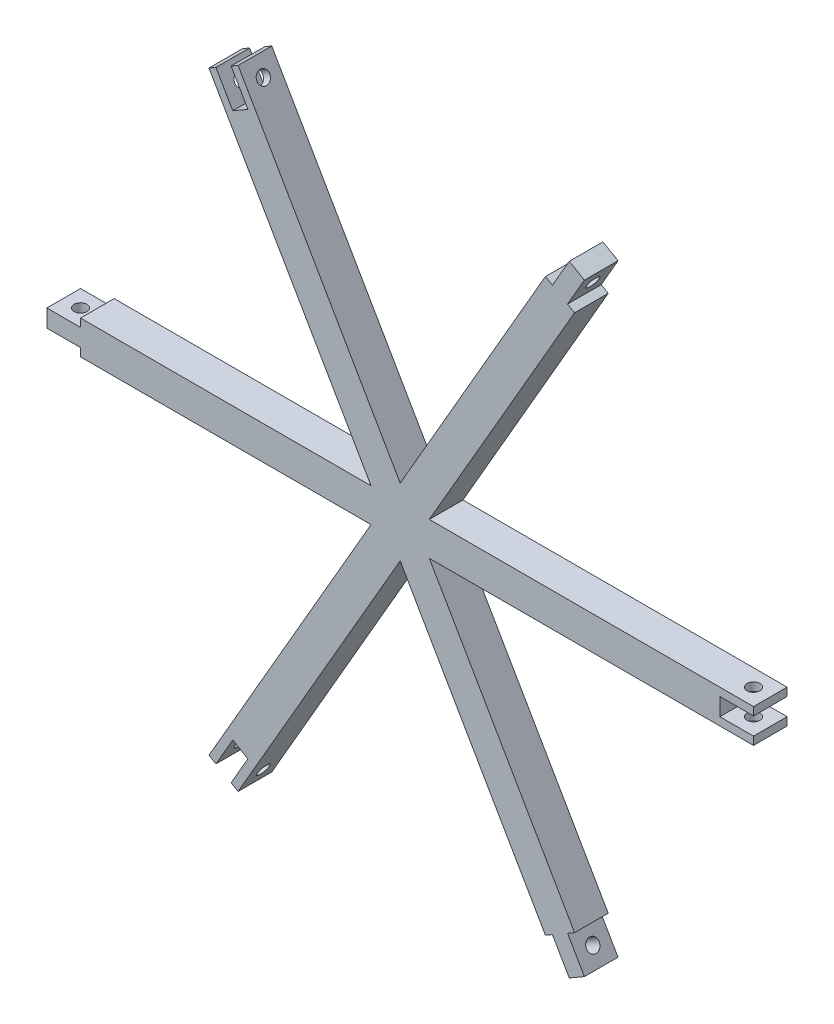
from build123d import *

# Parameters (mm, degrees)
SKETCH1_W               = 5
SKETCH1_H               = 5
SKETCH1_R               = 0.95
CENTER_DEPTH            = 1.3
RIGHTSIDE_START         = 1.3
SKETCH1_2_W             = 5
SKETCH1_2_H             = 5
SKETCH1_2_R             = 0.95
RIGHTSIDE_DEPTH         = 1.2
LEFTSIDE_START          = -1.3
SKETCH1_3_W             = 5
SKETCH1_3_H             = 5
SKETCH1_3_R             = 0.95
LEFTSIDE_DEPTH          = 1.2
SKETCH3_W               = 5
SKETCH3_H               = 5
BOSS_EXTRUDE4_DEPTH     = 47.5
CUT_EXTRUDE1_DEPTH      = 5
CIRPATTERN2_COUNT       = 6
CIRPATTERN3_COUNT       = 3
CIRPATTERN4_START       = -44.601270189
CIRPATTERN4_OUTLINE_W   = 5
CIRPATTERN4_OUTLINE_H   = 5
CIRPATTERN4_OUTLINE_R   = 0.95
CIRPATTERN4_DEPTH       = 2.6
CIRPATTERN4_2_OUTLINE_W = 5
CIRPATTERN4_2_OUTLINE_H = 5
CIRPATTERN4_2_OUTLINE_R = 0.95
CIRPATTERN4_2_DEPTH     = 2.6
CIRPATTERN4_START_2     = -1.3
CIRPATTERN4_3_OUTLINE_W = 5
CIRPATTERN4_3_OUTLINE_H = 5
CIRPATTERN4_3_OUTLINE_R = 0.95
CIRPATTERN4_3_DEPTH     = 2.6
SKETCH5_W               = 5
SKETCH5_H               = 2.6
CUT_EXTRUDE2_DEPTH      = 5


# Read off the part's stored shape, not the designer's step: CirPattern4
with BuildPart() as part:
    # Sketch1 → Center (new, symmetric)
    with BuildSketch(Plane(origin=(0, 0, 0), x_dir=(1, 0, 0), z_dir=(0, 1, 0))):
        Rectangle(SKETCH1_W, SKETCH1_H)
        with Locations(Location((0, 0, 0), (0, 0, 270))):
            Circle(SKETCH1_R, mode=Mode.SUBTRACT)
    extrude(amount=CENTER_DEPTH, both=True)

    # Sketch5 → Cut-Extrude2 (cut)
    with BuildSketch(Plane(origin=(2.5, 0, 0), x_dir=(0, 0, -1), z_dir=(1, 0, 0))):
        Rectangle(SKETCH5_W, SKETCH5_H)
    extrude(amount=-CUT_EXTRUDE2_DEPTH, mode=Mode.SUBTRACT)


with BuildPart() as body_2:
    # Sketch1<2> → RightSide (new body)
    with BuildSketch(Plane(origin=(0, 0, 0), x_dir=(1, 0, 0), z_dir=(0, 1, 0)).offset(RIGHTSIDE_START)):
        Rectangle(SKETCH1_2_W, SKETCH1_2_H)
        with Locations(Location((0, 0, 0), (0, 0, 270))):
            Circle(SKETCH1_2_R, mode=Mode.SUBTRACT)
    extrude(amount=RIGHTSIDE_DEPTH)


with BuildPart() as body_3:
    # Sketch1<3> → LeftSide (new body)
    with BuildSketch(Plane(origin=(0, 0, 0), x_dir=(1, 0, 0), z_dir=(0, 1, 0)).offset(LEFTSIDE_START)):
        Rectangle(SKETCH1_3_W, SKETCH1_3_H)
        with Locations(Location((0, 0, 0), (0, 0, 270))):
            Circle(SKETCH1_3_R, mode=Mode.SUBTRACT)
    extrude(amount=-LEFTSIDE_DEPTH)


with BuildPart() as body_4:
    # Sketch3 → Boss-Extrude4 (new body)
    with BuildSketch(Plane.ZY.offset(2.5)):
        Rectangle(SKETCH3_W, SKETCH3_H)
    extrude(amount=BOSS_EXTRUDE4_DEPTH)

    # Sketch4 → Cut-Extrude1 (cut)
    with BuildSketch(Plane.XY.offset(-2.5)):
        Polygon((-50, 0), (-50, -2.5), (-45.669872981, -2.5), align=None)
        Polygon((-50, 2.5), (-50, 0), (-45.669872981, 2.5), align=None)
    extrude(amount=CUT_EXTRUDE1_DEPTH, mode=Mode.SUBTRACT)


with BuildPart() as cirpattern2_1:
    # CirPattern2: pattern copy
    add(body_4.part.rotate(Axis((-50, 0, 0), (0, 0, 1)), 1 * 360 / CIRPATTERN2_COUNT))


with BuildPart() as cirpattern2_2:
    # CirPattern2: pattern copy
    add(body_4.part.rotate(Axis((-50, 0, 0), (0, 0, 1)), 2 * 360 / CIRPATTERN2_COUNT))


with BuildPart() as cirpattern2_3:
    # CirPattern2: pattern copy
    add(body_4.part.rotate(Axis((-50, 0, 0), (0, 0, 1)), 3 * 360 / CIRPATTERN2_COUNT))


with BuildPart() as cirpattern2_4:
    # CirPattern2: pattern copy
    add(body_4.part.rotate(Axis((-50, 0, 0), (0, 0, 1)), 4 * 360 / CIRPATTERN2_COUNT))


with BuildPart() as cirpattern2_5:
    # CirPattern2: pattern copy
    add(body_4.part.rotate(Axis((-50, 0, 0), (0, 0, 1)), 5 * 360 / CIRPATTERN2_COUNT))


with BuildPart() as cirpattern3_1:
    # CirPattern3: pattern copy
    add(body_3.part.rotate(Axis((-50, 0, 0), (0, 0, 1)), 1 * 360 / CIRPATTERN3_COUNT))


with BuildPart() as cirpattern3_2:
    # CirPattern3: pattern copy
    add(body_3.part.rotate(Axis((-50, 0, 0), (0, 0, 1)), 2 * 360 / CIRPATTERN3_COUNT))


with BuildPart() as cirpattern3_3:
    # CirPattern3: pattern copy
    add(body_2.part.rotate(Axis((-50, 0, 0), (0, 0, 1)), 1 * 360 / CIRPATTERN3_COUNT))


with BuildPart() as cirpattern3_4:
    # CirPattern3: pattern copy
    add(body_2.part.rotate(Axis((-50, 0, 0), (0, 0, 1)), 2 * 360 / CIRPATTERN3_COUNT))


with BuildPart() as body_14:
    # CirPattern4 outline → CirPattern4 (new body)
    with BuildSketch(Plane(origin=(0, 0, 0), x_dir=(0.49999999999999767, 0.86602540378444, 0), z_dir=(0.8660254037844399, -0.49999999999999795, 0)).offset(CIRPATTERN4_START)):
        with Locations((25, 0)):
            Rectangle(CIRPATTERN4_OUTLINE_W, CIRPATTERN4_OUTLINE_H)
        with Locations((25, 0)):
            Circle(CIRPATTERN4_OUTLINE_R, mode=Mode.SUBTRACT)
    extrude(amount=CIRPATTERN4_DEPTH)


with BuildPart() as body_15:
    # CirPattern4 2 outline → CirPattern4 2 (new body)
    with BuildSketch(Plane(origin=(0, 0, 0), x_dir=(0.5000000000000098, -0.8660254037844329, 0), z_dir=(0.8660254037844329, 0.50000000000001, 0)).offset(CIRPATTERN4_START)):
        with Locations((25, 0)):
            Rectangle(CIRPATTERN4_2_OUTLINE_W, CIRPATTERN4_2_OUTLINE_H)
        with Locations((25, 0)):
            Circle(CIRPATTERN4_2_OUTLINE_R, mode=Mode.SUBTRACT)
    extrude(amount=CIRPATTERN4_2_DEPTH)


with BuildPart() as body_16:
    # CirPattern4 3 outline → CirPattern4 3 (new body)
    with BuildSketch(Plane(origin=(0, 0, 0), x_dir=(1, 0, 0), z_dir=(0, 1, 0)).offset(CIRPATTERN4_START_2)):
        with Locations((-100, 0)):
            Rectangle(CIRPATTERN4_3_OUTLINE_W, CIRPATTERN4_3_OUTLINE_H)
        with Locations((-100, 0)):
            Circle(CIRPATTERN4_3_OUTLINE_R, mode=Mode.SUBTRACT)
    extrude(amount=CIRPATTERN4_3_DEPTH)


with BuildPart() as cirpattern2_5_1:
    add(cirpattern2_5.part)

    # Combine1: union CirPattern2_3, CirPattern2_4, body 16, CirPattern3_2, CirPattern3_4, body 15, CirPattern2_1, body 3, body 14, body 4, body 2, CirPattern2_2, CirPattern3_1, CirPattern3_3
    add(cirpattern2_3.part)
    add(cirpattern2_4.part)
    add(body_16.part)
    add(cirpattern3_2.part)
    add(cirpattern3_4.part)
    add(body_15.part)
    add(cirpattern2_1.part)
    add(body_3.part)
    add(body_14.part)
    add(body_4.part)
    add(body_2.part)
    add(cirpattern2_2.part)
    add(cirpattern3_1.part)
    add(cirpattern3_3.part)


solid = cirpattern2_5_1.part
